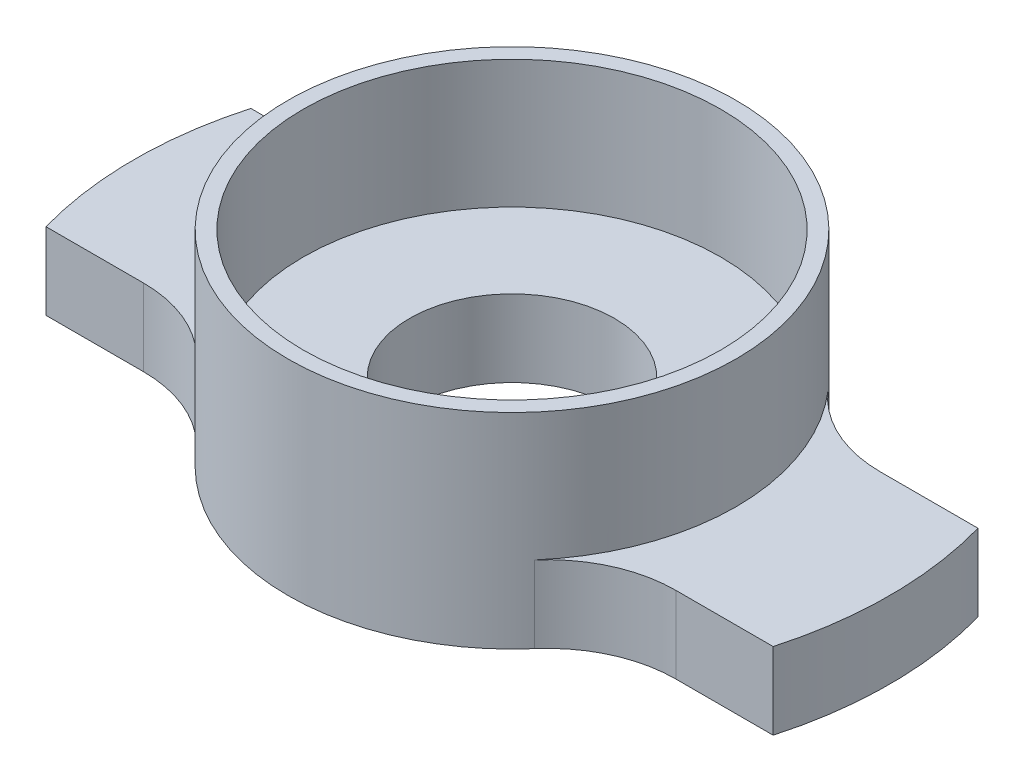
from build123d import *

# Parameters (mm, degrees)
SKETCH1_R           = 17.5
SKETCH1_R_2         = 16.3
BOSS_EXTRUDE1_DEPTH = 10
BOSS_EXTRUDE2_START = 6
SKETCH2_R           = 17.5
SKETCH2_R_2         = 8
BOSS_EXTRUDE2_DEPTH = 6
BOSS_EXTRUDE3_DEPTH = 6
FILLET1_R           = 10


with BuildPart() as part:
    # Sketch1 → Boss-Extrude1 (new body)
    with BuildSketch(Plane(origin=(0, 0, 0), x_dir=(1, 0, 0), z_dir=(0, 1, 0))):
        Circle(SKETCH1_R)
        Circle(SKETCH1_R_2, mode=Mode.SUBTRACT)
    extrude(amount=BOSS_EXTRUDE1_DEPTH)

    # Sketch2 → Boss-Extrude2 (add)
    with BuildSketch(Plane.XZ.offset(BOSS_EXTRUDE2_START)):
        Circle(SKETCH2_R)
        Circle(SKETCH2_R_2, mode=Mode.SUBTRACT)
    extrude(amount=-BOSS_EXTRUDE2_DEPTH)

    # Sketch4 → Boss-Extrude3 (add)
    with BuildSketch(Plane.XZ.offset(6)):
        with BuildLine():
            Line((-28.394541729, 8), (-8, 8))
            Line((-8, 8), (-8, -8))
            Line((-8, -8), (-28.394541729, -8))
            ThreePointArc((-28.394541729, -8), (-29.5, 0), (-28.394541729, 8))
        make_face()
        with BuildLine():
            Line((28.394541729, -8), (8, -8))
            Line((8, -8), (8, 8))
            Line((8, 8), (28.394541729, 8))
            ThreePointArc((28.394541729, 8), (29.5, 0), (28.394541729, -8))
        make_face()
    extrude(amount=-BOSS_EXTRUDE3_DEPTH)

    # Fillet1
    fillet1_edges = [part.edges().sort_by_distance(p)[0] for p in [
        (15.564382416, -3, -8),
        (15.564382416, -3, 8),
        (-15.564382416, -3, -8),
        (-15.564382416, -3, 8),
    ]]
    fillet(fillet1_edges, radius=FILLET1_R)


solid = part.part
